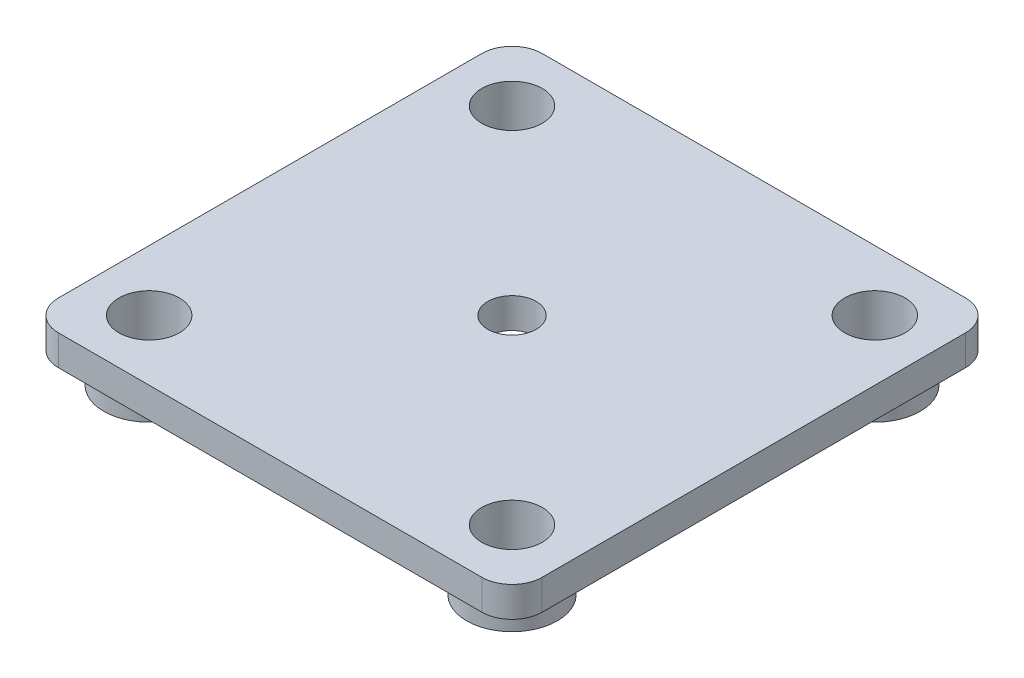
from build123d import *

# Parameters (mm, degrees)
SKETCH1_W           = 80
SKETCH1_H           = 80
SKETCH1_R           = 5
BOSS_EXTRUDE1_DEPTH = 5
EXTRUDE_THIN1_START = 5
SKETCH2_R           = 7.5
SKETCH2_R_2         = 5
EXTRUDE_THIN1_DEPTH = 5
SKETCH3_R           = 4
CUT_EXTRUDE1_DEPTH  = 58.445626465
FILLET1_R           = 5


with BuildPart() as part:
    # Sketch1 → Boss-Extrude1 (new body)
    with BuildSketch(Plane(origin=(0, 0, 0), x_dir=(1, 0, 0), z_dir=(0, 1, 0))):
        Rectangle(SKETCH1_W, SKETCH1_H)
        with Locations((-30, 30)):
            Circle(SKETCH1_R, mode=Mode.SUBTRACT)
        with Locations((30, 30)):
            Circle(SKETCH1_R, mode=Mode.SUBTRACT)
        with Locations((30, -30)):
            Circle(SKETCH1_R, mode=Mode.SUBTRACT)
        with Locations((-30, -30)):
            Circle(SKETCH1_R, mode=Mode.SUBTRACT)
    extrude(amount=BOSS_EXTRUDE1_DEPTH)

    # Sketch2 → Extrude-Thin1 (add)
    # profile 1 of 4: a face of its own
    with BuildSketch(Plane.XZ.offset(EXTRUDE_THIN1_START)):
        with Locations((-30, -30)):
            Circle(SKETCH2_R)
        with Locations((-30, -30)):
            Circle(SKETCH2_R_2, mode=Mode.SUBTRACT)
    # profile 2 of 4: a face of its own
    with BuildSketch(Plane.XZ.offset(EXTRUDE_THIN1_START)):
        with Locations((30, -30)):
            Circle(SKETCH2_R)
        with Locations((30, -30)):
            Circle(SKETCH2_R_2, mode=Mode.SUBTRACT)
    # profile 3 of 4: a face of its own
    with BuildSketch(Plane.XZ.offset(EXTRUDE_THIN1_START)):
        with Locations((30, 30)):
            Circle(SKETCH2_R)
        with Locations((30, 30)):
            Circle(SKETCH2_R_2, mode=Mode.SUBTRACT)
    # profile 4 of 4: a face of its own
    with BuildSketch(Plane.XZ.offset(EXTRUDE_THIN1_START)):
        with Locations((-30, 30)):
            Circle(SKETCH2_R)
        with Locations((-30, 30)):
            Circle(SKETCH2_R_2, mode=Mode.SUBTRACT)
    extrude(amount=-EXTRUDE_THIN1_DEPTH)

    # Sketch3 → Cut-Extrude1 (cut, through all)
    with BuildSketch(Plane(origin=(0, 5, 0), x_dir=(1, 0, 0), z_dir=(0, 1, 0))):
        Circle(SKETCH3_R)
    extrude(amount=-CUT_EXTRUDE1_DEPTH, mode=Mode.SUBTRACT)

    # Fillet1
    fillet1_edges = [part.edges().sort_by_distance(p)[0] for p in [
        (-40, 2.5, 40),
        (-40, 2.5, -40),
        (40, 2.5, 40),
        (40, 2.5, -40),
    ]]
    fillet(fillet1_edges, radius=FILLET1_R)


solid = part.part
